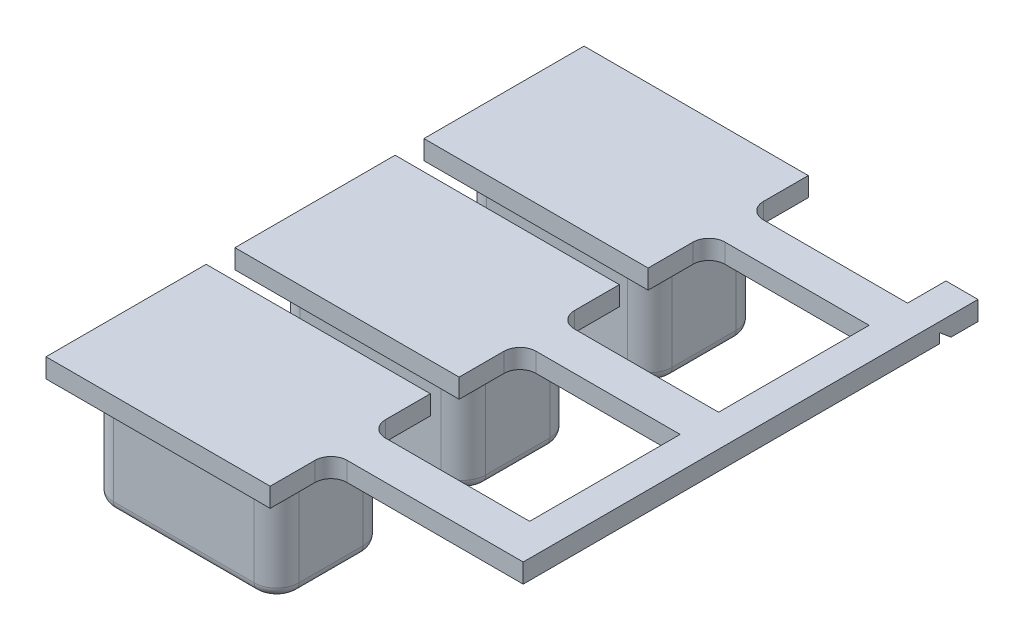
from build123d import *

# Parameters (mm, degrees)
EXTRUDE_1_DEPTH     = 4
EXTRUDE_1_2_DEPTH   = 4
EXTRUDE_1_3_DEPTH   = 4
SKETCH_2_W          = 7
SKETCH_2_H          = 5
EXTRUDE_2_DEPTH     = 0.6
SKETCH_3_W          = 6
SKETCH_3_H          = 1.2
EXTRUDE_3_DEPTH     = 0.6
SKETCH_4_W          = 1
SKETCH_4_H          = 13
EXTRUDE_4_DEPTH     = 0.6
FILLET_1_R          = 0.5
SKETCH_5_W          = 1
SKETCH_5_H          = 0.6
EXTRUDE_5_DEPTH     = 1.2
CUT_EXTRUDE_1_DEPTH = 1
FILLET_2_R          = 0.3


with BuildPart() as part:
    # 草图1 → 凸台-拉伸1 (new body)
    with BuildSketch(Plane(origin=(0, 0, 0), x_dir=(1, 0, 0), z_dir=(0, 1, 0))):
        with BuildLine():
            Line((-2.2, 1.7), (2.2, 1.7))
            ThreePointArc((2.2, 1.7), (2.694974747, 1.494974747), (2.9, 1))
            Line((2.9, 1), (2.9, -1))
            ThreePointArc((2.9, -1), (2.694974747, -1.494974747), (2.2, -1.7))
            Line((2.2, -1.7), (-2.2, -1.7))
            ThreePointArc((-2.2, -1.7), (-2.694974747, -1.494974747), (-2.9, -1))
            Line((-2.9, -1), (-2.9, 1))
            ThreePointArc((-2.9, 1), (-2.694974747, 1.494974747), (-2.2, 1.7))
        make_face()
    extrude(amount=EXTRUDE_1_DEPTH)



with BuildPart() as body_2:
    # 草图1 → Extrude 1 2 (new body)
    with BuildSketch(Plane(origin=(0, 0, 0), x_dir=(1, 0, 0), z_dir=(0, 1, 0))):
        with BuildLine():
            Line((-2.2, 7.528722779), (2.2, 7.528722779))
            ThreePointArc((2.2, 7.528722779), (2.694974747, 7.323697526), (2.9, 6.828722779))
            Line((2.9, 6.828722779), (2.9, 4.828722779))
            ThreePointArc((2.9, 4.828722779), (2.694974747, 4.333748032), (2.2, 4.128722779))
            Line((2.2, 4.128722779), (-2.2, 4.128722779))
            ThreePointArc((-2.2, 4.128722779), (-2.694974747, 4.333748032), (-2.9, 4.828722779))
            Line((-2.9, 4.828722779), (-2.9, 6.828722779))
            ThreePointArc((-2.9, 6.828722779), (-2.694974747, 7.323697526), (-2.2, 7.528722779))
        make_face()
    extrude(amount=EXTRUDE_1_2_DEPTH)


with BuildPart() as body_3:
    # 草图1 → Extrude 1 3 (new body)
    with BuildSketch(Plane(origin=(0, 0, 0), x_dir=(1, 0, 0), z_dir=(0, 1, 0))):
        with BuildLine():
            Line((-2.2, 13.349128593), (2.2, 13.349128593))
            ThreePointArc((2.2, 13.349128593), (2.694974747, 13.144103339), (2.9, 12.649128593))
            Line((2.9, 12.649128593), (2.9, 10.649128593))
            ThreePointArc((2.9, 10.649128593), (2.694974747, 10.154153846), (2.2, 9.949128593))
            Line((2.2, 9.949128593), (-2.2, 9.949128593))
            ThreePointArc((-2.2, 9.949128593), (-2.694974747, 10.154153846), (-2.9, 10.649128593))
            Line((-2.9, 10.649128593), (-2.9, 12.649128593))
            ThreePointArc((-2.9, 12.649128593), (-2.694974747, 13.144103339), (-2.2, 13.349128593))
        make_face()
    extrude(amount=EXTRUDE_1_3_DEPTH)


with BuildPart() as part_1:
    add(part.part)

    add(body_2.part)  # 凸台-拉伸2 merges body 2

    add(body_3.part)  # 凸台-拉伸2 merges body 3
    # 草图2 → 凸台-拉伸2 (add)
    with BuildSketch(Plane(origin=(0, 4, 0), x_dir=(1, 0, 0), z_dir=(0, 1, 0))):
        with Locations((0.036699987, 11.763062551)):
            Rectangle(SKETCH_2_W, SKETCH_2_H)
        with Locations((0.036699987, 5.863062551)):
            Rectangle(SKETCH_2_W, SKETCH_2_H)
        with Locations((0.036699987, -0.036937449)):
            Rectangle(SKETCH_2_W, SKETCH_2_H)
    extrude(amount=-EXTRUDE_2_DEPTH)

    # 草图3 → 凸台-拉伸3 (add)
    with BuildSketch(Plane(origin=(0, 4, 0), x_dir=(1, 0, 0), z_dir=(0, 1, 0))):
        with Locations((6.536699987, 11.763062551)):
            Rectangle(SKETCH_3_W, SKETCH_3_H)
        with Locations((6.536699987, 5.863062551)):
            Rectangle(SKETCH_3_W, SKETCH_3_H)
        with Locations((6.536699987, -0.036937449)):
            Rectangle(SKETCH_3_W, SKETCH_3_H)
    extrude(amount=-EXTRUDE_3_DEPTH)

    # 草图4 → 凸台-拉伸4 (add)
    with BuildSketch(Plane.XZ.offset(-3.4)):
        with Locations((9.036699987, -5.863062551)):
            Rectangle(SKETCH_4_W, SKETCH_4_H)
    extrude(amount=-EXTRUDE_4_DEPTH)

    # 圆角1
    fillet_1_edges = [part_1.edges().sort_by_distance(p)[0] for p in [
        (3.536699987, 3.7, -12.363062551),
        (3.536699987, 3.7, -11.163062551),
        (3.536699987, 3.7, -5.263062551),
        (3.536699987, 3.7, -6.463062551),
        (3.536699987, 3.7, 0.636937449),
        (3.536699987, 3.7, -0.563062551),
    ]]
    fillet(fillet_1_edges, radius=FILLET_1_R)

    # 草图5 → 凸台-拉伸5 (add)
    with BuildSketch(Plane(origin=(0, 0, -12.363062551), x_dir=(-1, 0, 0), z_dir=(0, 0, -1))):
        with Locations((-9.036699987, 3.7)):
            Rectangle(SKETCH_5_W, SKETCH_5_H)
    extrude(amount=EXTRUDE_5_DEPTH)

    # 草图6 → 切除-拉伸1 (cut)
    with BuildSketch(Plane.ZY.offset(-8.536699987)):
        Polygon((-12.363062551, 3.4), (-12.363062551, 3.7), (-12.720178884, 3.4), align=None)
    extrude(amount=-CUT_EXTRUDE_1_DEPTH, mode=Mode.SUBTRACT)

    # 圆角2
    fillet_2_edges = [part_1.edges().sort_by_distance(p)[0] for p in [
        (2.694974747, 0, -13.144103339),
        (2.9, 0, -11.649128593),
        (2.694974747, 0, -10.154153846),
        (0, 0, -9.949128593),
        (-2.694974747, 0, -10.154153846),
        (-2.9, 0, -11.649128593),
        (-2.694974747, 0, -13.144103339),
        (2.694974747, 0, -7.323697526),
        (2.9, 0, -5.828722779),
        (2.694974747, 0, -4.333748032),
        (0, 0, -4.128722779),
        (-2.694974747, 0, -4.333748032),
        (-2.9, 0, -5.828722779),
        (-2.694974747, 0, -7.323697526),
        (2.694974747, 0, -1.494974747),
        (2.9, 0, 0),
        (2.694974747, 0, 1.494974747),
        (0, 0, 1.7),
        (-2.694974747, 0, 1.494974747),
        (-2.9, 0, 0),
        (-2.694974747, 0, -1.494974747),
        (0, 0, -13.349128593),
        (0, 0, -7.528722779),
        (0, 0, -1.7),
    ]]
    fillet(fillet_2_edges, radius=FILLET_2_R)


solid = part_1.part
